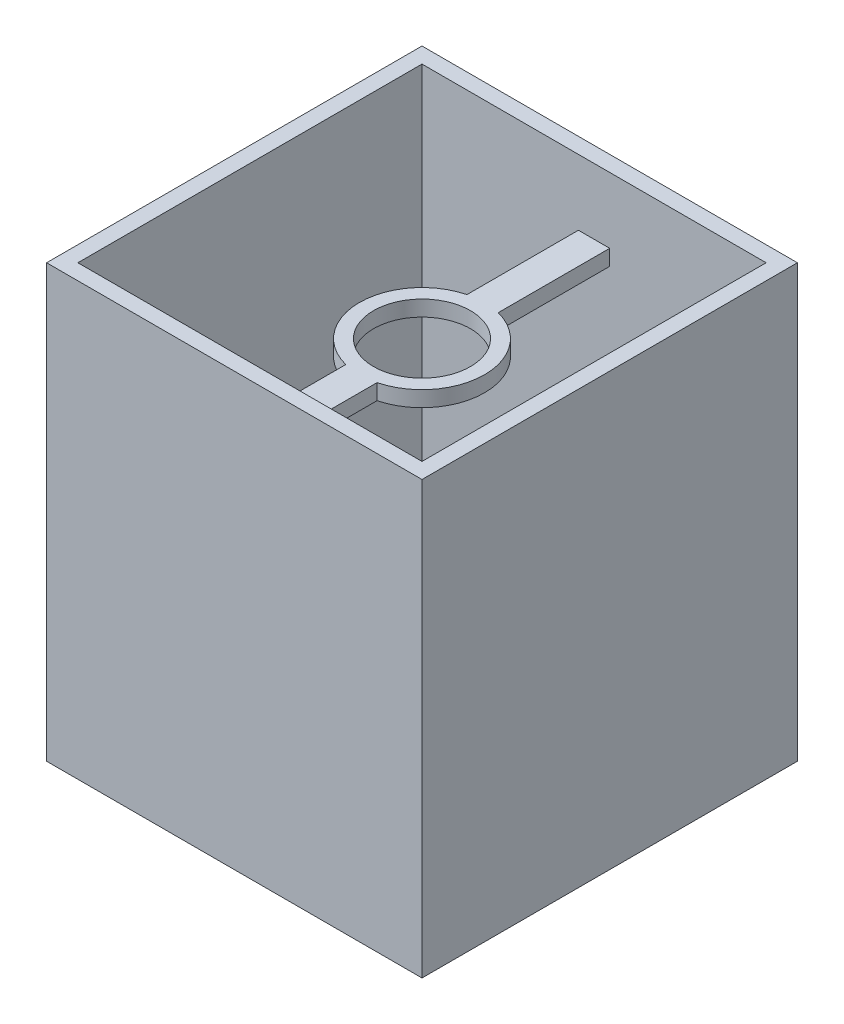
from build123d import *
from build123d.topology import SkipClean

# Parameters (mm, degrees)
SKETCH1_W           = 60
SKETCH1_H           = 60
BOSS_EXTRUDE1_DEPTH = 69
SKETCH2_W           = 55
SKETCH2_H           = 55
CUT_EXTRUDE1_DEPTH  = 66.5
SKETCH3_R           = 1.5
CUT_EXTRUDE2_DEPTH  = 1.875
THREAD4_PITCH       = 0.5
THREAD5_PITCH       = 0.5
BOSS_EXTRUDE2_DEPTH = 2.5


with BuildPart() as part:
    # Sketch1 → Boss-Extrude1 (new body)
    with BuildSketch(Plane(origin=(0, 0, 0), x_dir=(1, 0, 0), z_dir=(0, 1, 0))):
        Rectangle(SKETCH1_W, SKETCH1_H)
    extrude(amount=BOSS_EXTRUDE1_DEPTH)

    # Sketch2 → Cut-Extrude1 (cut)
    with BuildSketch(Plane(origin=(0, 69, 0), x_dir=(1, 0, 0), z_dir=(0, 1, 0))):
        Rectangle(SKETCH2_W, SKETCH2_H)
    extrude(amount=-CUT_EXTRUDE1_DEPTH, mode=Mode.SUBTRACT)

    # Sketch3 → Cut-Extrude2 (cut)
    with BuildSketch(Plane(origin=(0, 2.5, 0), x_dir=(1, 0, 0), z_dir=(0, 1, 0))):
        with Locations(Location((16.36, 2.5, 0), (0, 0, 270))):
            Circle(SKETCH3_R)
        with Locations(Location((16.36, -2.5, 0), (0, 0, 270))):
            Circle(SKETCH3_R)
    extrude(amount=-CUT_EXTRUDE2_DEPTH, mode=Mode.SUBTRACT)

    # Thread4: the profile of Thread Profile5 profile screwed along a right-hand helix of 3.75 turns, 6 arcs to a turn; built about Z, then put on its axis
    with SkipClean():  # the faces are left unmerged after this step: merging them gives an invalid solid
        thread4_z = Axis((0, 0, 0), (0, 0, 1))
        thread4_corners = [(1.4997, 0, -0.000173205), (1.770632938, 0, 0.156249999), (1.770632938, 0, 0.218749999), (1.4997, 0, 0.375173204)]
        with BuildLine(mode=Mode.PRIVATE) as thread4_profile:
            Line(thread4_corners[0], thread4_corners[1])
            Line(thread4_corners[1], thread4_corners[2])
            Line(thread4_corners[2], thread4_corners[3])
            Line(thread4_corners[3], thread4_corners[0])
        thread4_cap = Face(thread4_profile.wire())
        thread4_turn_angles = [0, 30, 60, 90, 120, 150, 180, 210, 240, 270, 300, 330, 360]
        thread4_turn_weights = [1, 0.8660254037844387, 1, 0.8660254037844387, 1, 0.8660254037844387, 1, 0.8660254037844387, 1, 0.8660254037844387, 1, 0.8660254037844387, 1]
        thread4_turn_rails = [Edge.make_bspline([Vector(p[0], p[1], 0).rotate(thread4_z, thread4_turn_angles[k]) / thread4_turn_weights[k] + Vector(0, 0, p[2] + THREAD4_PITCH * thread4_turn_angles[k] / 360) for k in range(13)], [0, 0, 0, 1, 1, 2, 2, 3, 3, 4, 4, 5, 5, 6, 6, 6], 2, thread4_turn_weights) for p in thread4_corners]
        thread4_turn_sides = [Face.make_surface_from_curves(thread4_turn_rails[p[0]], thread4_turn_rails[p[1]]) for p in [(0, 1), (1, 2), (2, 3), (3, 0)]]
        thread4_turn = Solid(Shell([*thread4_turn_sides, thread4_cap, thread4_cap.rotate(thread4_z, 360).moved(Location((0, 0, THREAD4_PITCH * 360 / 360)))]))
        thread4_last_angles = [1080, 1110, 1140, 1170, 1200, 1230, 1260, 1290, 1320, 1335, 1350]
        thread4_last_weights = [1, 0.8660254037844387, 1, 0.8660254037844387, 1, 0.8660254037844387, 1, 0.8660254037844387, 1, 0.9659258262890683, 1]
        thread4_last_rails = [Edge.make_bspline([Vector(p[0], p[1], 0).rotate(thread4_z, thread4_last_angles[k]) / thread4_last_weights[k] + Vector(0, 0, p[2] + THREAD4_PITCH * thread4_last_angles[k] / 360) for k in range(11)], [0, 0, 0, 1, 1, 2, 2, 3, 3, 4, 4, 5, 5, 5], 2, thread4_last_weights) for p in thread4_corners]
        thread4_last_sides = [Face.make_surface_from_curves(thread4_last_rails[p[0]], thread4_last_rails[p[1]]) for p in [(0, 1), (1, 2), (2, 3), (3, 0)]]
        thread4_last = Solid(Shell([*thread4_last_sides, thread4_cap.rotate(thread4_z, 1080).moved(Location((0, 0, THREAD4_PITCH * 1080 / 360))), thread4_cap.rotate(thread4_z, 1350).moved(Location((0, 0, THREAD4_PITCH * 1350 / 360)))]))
        thread4_each = [*[thread4_turn.moved(Location((0, 0, THREAD4_PITCH * i))) for i in range(3)], thread4_last]
        add(Plane(origin=(16.36, 2.5, -2.5), x_dir=(-1, 0, 0), z_dir=(0, -1, 0)) * Compound([thread4_each[i] for i in range(0, 4, 2)]), mode=Mode.SUBTRACT)
        add(Plane(origin=(16.36, 2.5, -2.5), x_dir=(-1, 0, 0), z_dir=(0, -1, 0)) * Compound([thread4_each[i] for i in range(1, 4, 2)]), mode=Mode.SUBTRACT)

    # Thread5: the profile of Thread Profile6 profile screwed along a right-hand helix of 3.75 turns, 6 arcs to a turn; built about Z, then put on its axis
    with SkipClean():  # the faces are left unmerged after this step: merging them gives an invalid solid
        thread5_z = Axis((0, 0, 0), (0, 0, 1))
        thread5_corners = [(1.4997, 0, -0.000173205), (1.770632938, 0, 0.156249999), (1.770632938, 0, 0.218749999), (1.4997, 0, 0.375173204)]
        with BuildLine(mode=Mode.PRIVATE) as thread5_profile:
            Line(thread5_corners[0], thread5_corners[1])
            Line(thread5_corners[1], thread5_corners[2])
            Line(thread5_corners[2], thread5_corners[3])
            Line(thread5_corners[3], thread5_corners[0])
        thread5_cap = Face(thread5_profile.wire())
        thread5_turn_angles = [0, 30, 60, 90, 120, 150, 180, 210, 240, 270, 300, 330, 360]
        thread5_turn_weights = [1, 0.8660254037844387, 1, 0.8660254037844387, 1, 0.8660254037844387, 1, 0.8660254037844387, 1, 0.8660254037844387, 1, 0.8660254037844387, 1]
        thread5_turn_rails = [Edge.make_bspline([Vector(p[0], p[1], 0).rotate(thread5_z, thread5_turn_angles[k]) / thread5_turn_weights[k] + Vector(0, 0, p[2] + THREAD5_PITCH * thread5_turn_angles[k] / 360) for k in range(13)], [0, 0, 0, 1, 1, 2, 2, 3, 3, 4, 4, 5, 5, 6, 6, 6], 2, thread5_turn_weights) for p in thread5_corners]
        thread5_turn_sides = [Face.make_surface_from_curves(thread5_turn_rails[p[0]], thread5_turn_rails[p[1]]) for p in [(0, 1), (1, 2), (2, 3), (3, 0)]]
        thread5_turn = Solid(Shell([*thread5_turn_sides, thread5_cap, thread5_cap.rotate(thread5_z, 360).moved(Location((0, 0, THREAD5_PITCH * 360 / 360)))]))
        thread5_last_angles = [1080, 1110, 1140, 1170, 1200, 1230, 1260, 1290, 1320, 1335, 1350]
        thread5_last_weights = [1, 0.8660254037844387, 1, 0.8660254037844387, 1, 0.8660254037844387, 1, 0.8660254037844387, 1, 0.9659258262890683, 1]
        thread5_last_rails = [Edge.make_bspline([Vector(p[0], p[1], 0).rotate(thread5_z, thread5_last_angles[k]) / thread5_last_weights[k] + Vector(0, 0, p[2] + THREAD5_PITCH * thread5_last_angles[k] / 360) for k in range(11)], [0, 0, 0, 1, 1, 2, 2, 3, 3, 4, 4, 5, 5, 5], 2, thread5_last_weights) for p in thread5_corners]
        thread5_last_sides = [Face.make_surface_from_curves(thread5_last_rails[p[0]], thread5_last_rails[p[1]]) for p in [(0, 1), (1, 2), (2, 3), (3, 0)]]
        thread5_last = Solid(Shell([*thread5_last_sides, thread5_cap.rotate(thread5_z, 1080).moved(Location((0, 0, THREAD5_PITCH * 1080 / 360))), thread5_cap.rotate(thread5_z, 1350).moved(Location((0, 0, THREAD5_PITCH * 1350 / 360)))]))
        thread5_each = [*[thread5_turn.moved(Location((0, 0, THREAD5_PITCH * i))) for i in range(3)], thread5_last]
        add(Plane(origin=(16.36, 2.5, 2.5), x_dir=(-1, 0, 0), z_dir=(0, -1, 0)) * Compound([thread5_each[i] for i in range(0, 4, 2)]), mode=Mode.SUBTRACT)
        add(Plane(origin=(16.36, 2.5, 2.5), x_dir=(-1, 0, 0), z_dir=(0, -1, 0)) * Compound([thread5_each[i] for i in range(1, 4, 2)]), mode=Mode.SUBTRACT)

    # Sketch6 → Boss-Extrude2 (add)
    with SkipClean():  # the faces are left unmerged after this step: merging them gives an invalid solid
        with BuildSketch(Plane(origin=(0, 58.5, 0), x_dir=(1, 0, 0), z_dir=(0, 1, 0))):
            with BuildLine():
                Line((0, 27.5), (0, 10))
                ThreePointArc((0, 10), (1.260042925, 9.920296963), (2.5, 9.682458366))
                Line((2.5, 9.682458366), (2.5, 27.5))
                Line((2.5, 27.5), (0, 27.5))
            make_face()
            with BuildLine():
                Line((-2.5, 27.5), (-2.5, 9.682458366))
                ThreePointArc((-2.5, 9.682458366), (-1.260042925, 9.920296963), (0, 10))
                Line((0, 10), (0, 27.5))
                Line((0, 27.5), (-2.5, 27.5))
            make_face()
            with BuildLine():
                ThreePointArc((-2.5, -9.682458366), (-1.260042925, -9.920296963), (0, -10))
                Line((0, -10), (0, -7.75))
                ThreePointArc((0, -7.75), (-7.75, 0), (0, 7.75))
                Line((0, 7.75), (0, 10))
                ThreePointArc((0, 10), (-1.260042925, 9.920296963), (-2.5, 9.682458366))
                ThreePointArc((-2.5, 9.682458366), (-10, 0), (-2.5, -9.682458366))
            make_face()
            with BuildLine():
                Line((0, -7.75), (0, -10))
                ThreePointArc((0, -10), (1.260042925, -9.920296963), (2.5, -9.682458366))
                ThreePointArc((2.5, -9.682458366), (7.90569415, -6.123724357), (10, 0))
                ThreePointArc((10, 0), (7.90569415, 6.123724357), (2.5, 9.682458366))
                ThreePointArc((2.5, 9.682458366), (1.260042925, 9.920296963), (0, 10))
                Line((0, 10), (0, 7.75))
                ThreePointArc((0, 7.75), (5.480077554, 5.480077554), (7.75, 0))
                ThreePointArc((7.75, 0), (5.480077554, -5.480077554), (0, -7.75))
            make_face()
            with BuildLine():
                Line((0, -10), (0, -27.5))
                Line((0, -27.5), (2.5, -27.5))
                Line((2.5, -27.5), (2.5, -9.682458366))
                ThreePointArc((2.5, -9.682458366), (1.260042925, -9.920296963), (0, -10))
            make_face()
            with BuildLine():
                Line((-2.5, -27.5), (0, -27.5))
                Line((0, -27.5), (0, -10))
                ThreePointArc((0, -10), (-1.260042925, -9.920296963), (-2.5, -9.682458366))
                Line((-2.5, -9.682458366), (-2.5, -27.5))
            make_face()
        extrude(amount=-BOSS_EXTRUDE2_DEPTH)


solid = part.part
